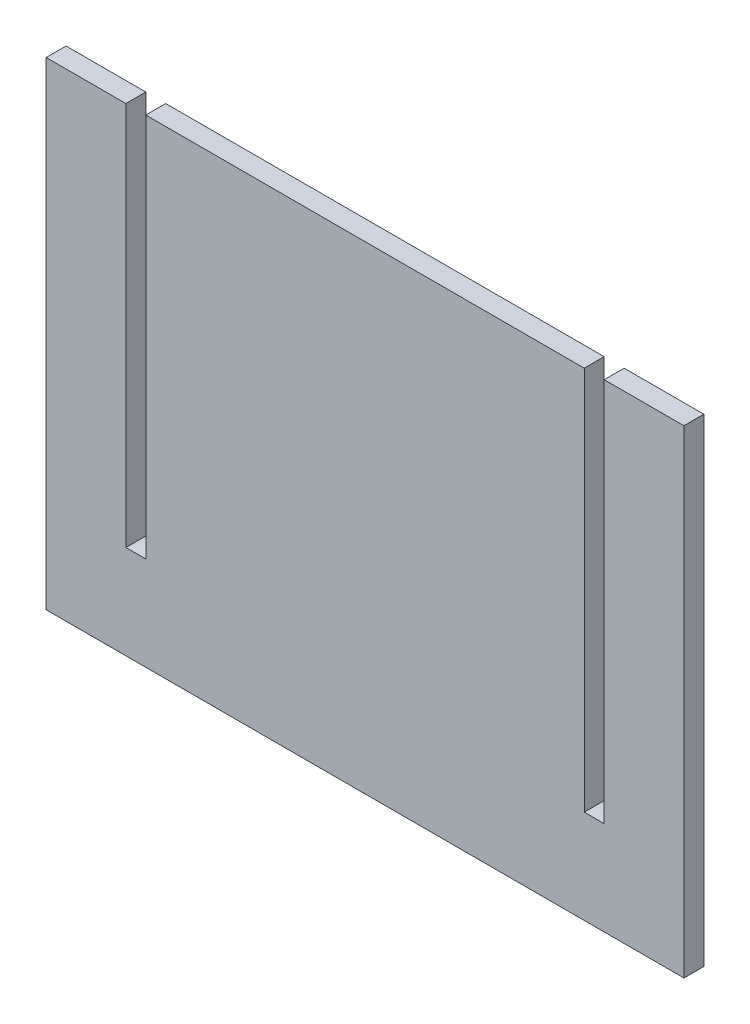
from build123d import *

# Parameters (mm, degrees)
BOSS_EXTRUDE1_DEPTH = 3.175


with BuildPart() as part:
    # Sketch1 → Boss-Extrude1 (new body)
    with BuildSketch(Plane.XY):
        Polygon((85.725, 76.2), (15.875, 76.2), (15.875, 14.942805851), (12.7, 14.942805851), (12.7, 76.2), (0, 76.2), (0, 0), (101.6, 0), (101.6, 76.2), (88.9, 76.2), (88.9, 14.942805851), (85.725, 14.942805851), align=None)
    extrude(amount=BOSS_EXTRUDE1_DEPTH)


solid = part.part
